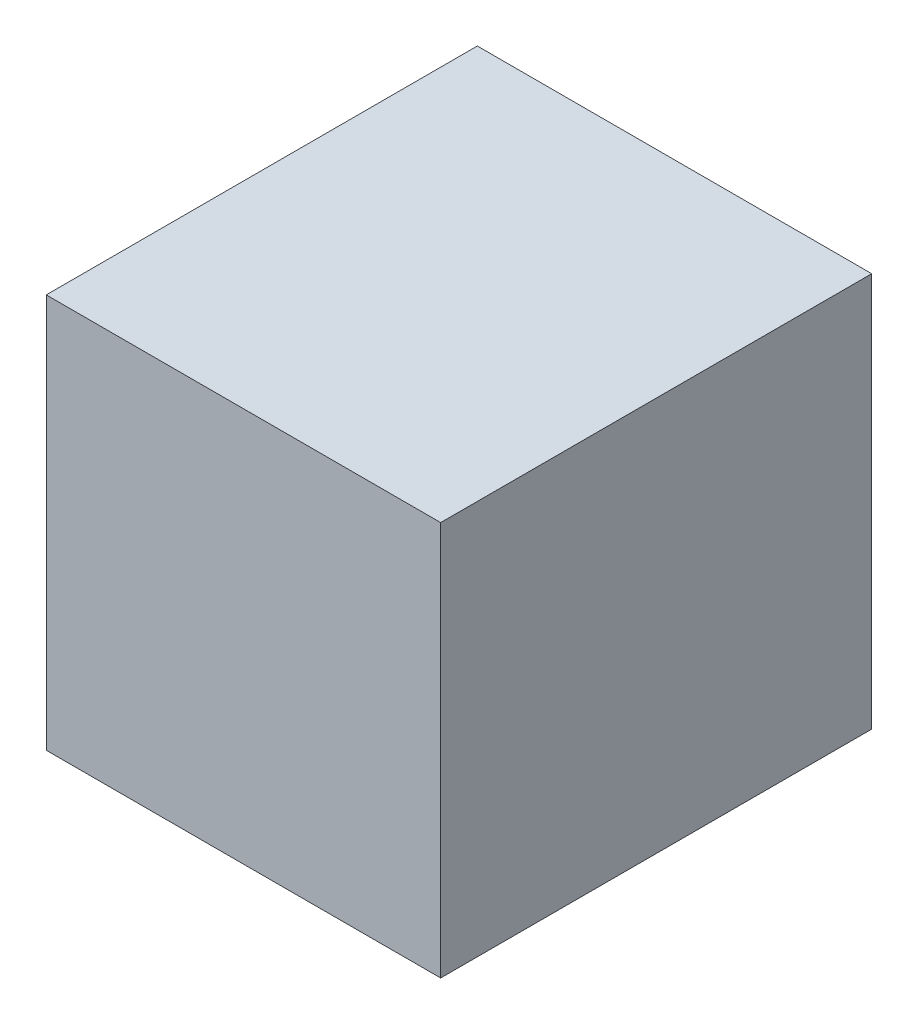
from build123d import *


with BuildPart() as part:
    # 草图1 → 放样1 section 0
    with BuildSketch(Plane.XY):
        with BuildLine():
            Line((0, 0), (100, 0))
            Line((100, 0), (100, 100))
            Line((100, 100), (0, 100))
            Line((0, 100), (0, 0))
        make_face()
    # 草图2 → 放样1 section 1
    with BuildSketch(Plane.XY.offset(86.6)):
        with BuildLine():
            Line((-22.694679656, -22.694679656), (77.305320344, -22.694679656))
            Line((77.305320344, -22.694679656), (77.305320344, 77.305320344))
            Line((77.305320344, 77.305320344), (-22.694679656, 77.305320344))
            Line((-22.694679656, 77.305320344), (-22.694679656, -22.694679656))
        make_face()
    loft()


solid = part.part
